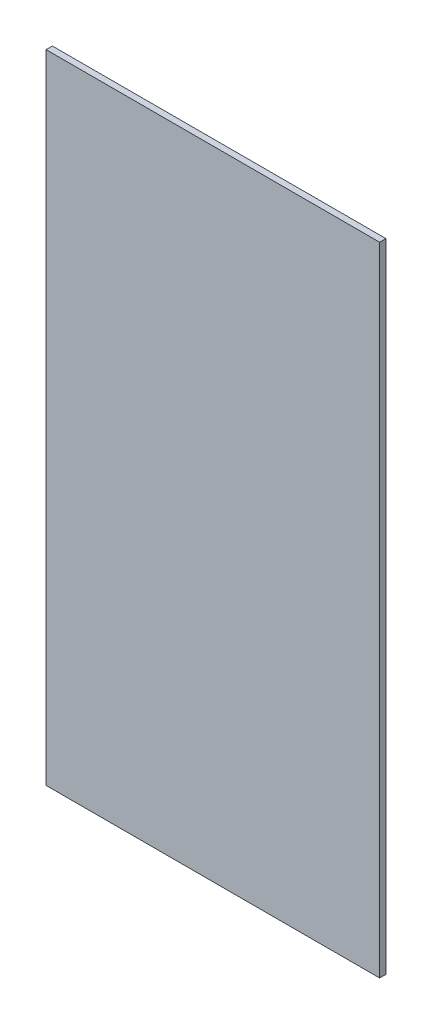
from build123d import *

# Parameters (mm, degrees)
SKETCH_1_W      = 530
SKETCH_1_H      = 1012.57
EXTRUDE_1_DEPTH = 10


with BuildPart() as part:
    # Эскиз1 → Бобышка-Вытянуть1 (new body)
    with BuildSketch(Plane.XY):
        with Locations((-265, 0)):
            Rectangle(SKETCH_1_W, SKETCH_1_H)
    extrude(amount=-EXTRUDE_1_DEPTH)


solid = part.part
